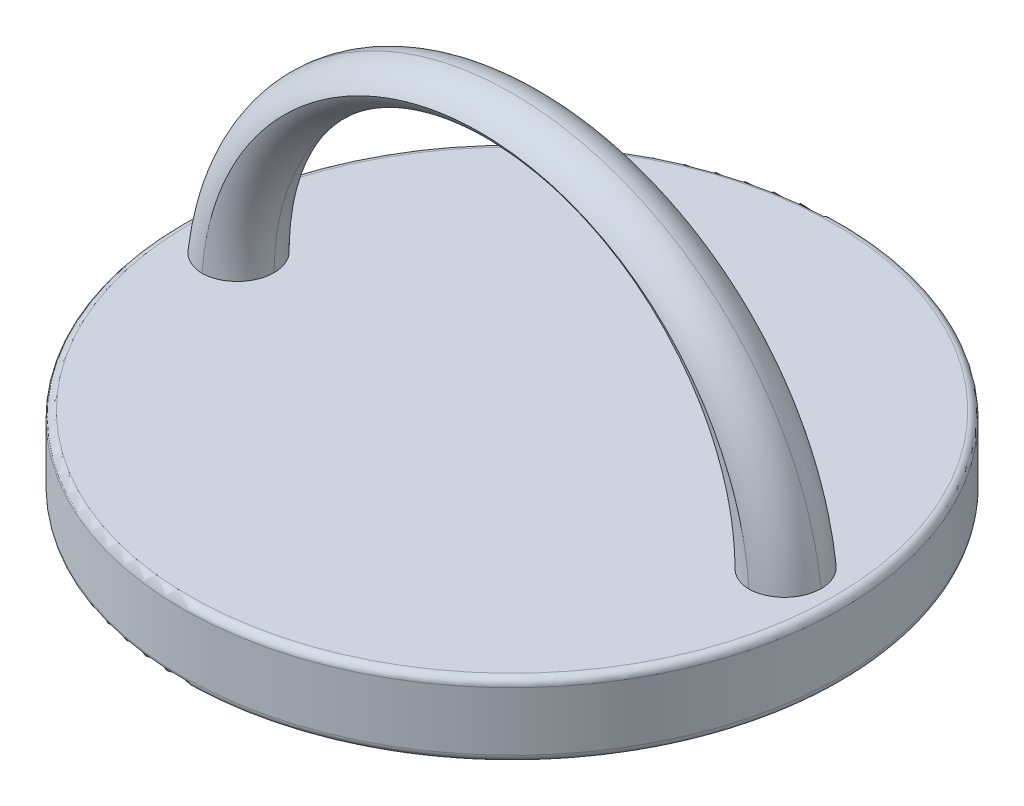
from build123d import *

# Parameters (mm, degrees)
BOSS_EXTRUDE1_DEPTH = 10
FILLET1_R           = 5
FILLET2_R           = 1


# Some blends are built 0.0001 mm under size
with BuildPart() as part:
    # Sketch1 → Revolve1 (revolve)
    with BuildSketch(Plane.XY, mode=Mode.PRIVATE) as revolve1_sk:
        with BuildLine():
            Line((45, 0), (0, 0))
            Line((0, 0), (0, -5))
            Line((0, -5), (41, -5))
            ThreePointArc((41, -5), (42.414213562, -5.585786438), (43, -7))
            Line((43, -7), (43, -10))
            Line((43, -10), (45, -10))
            Line((45, -10), (45, 0))
        make_face()
    revolve(revolve1_sk.sketch.rotate(Axis((0, 0, 0), (0, -1, 0)), 180), axis=Axis((0, 0, 0), (0, -1, 0)))

    # Sketch2 → Boss-Extrude1 (add)
    with BuildSketch(Plane.XY.offset(5)):
        with BuildLine():
            ThreePointArc((42.20485754, 0), (0, 37.5), (-42.20485754, 0))
            Line((-42.20485754, 0), (-32.5, 0))
            ThreePointArc((-32.5, 0), (0, 32.5), (32.5, 0))
            Line((32.5, 0), (42.20485754, 0))
        make_face()
    extrude(amount=-BOSS_EXTRUDE1_DEPTH)

    # Fillet1
    # the kernel refuses this fillet: 5 mm, written as the material it takes off along each edge
    with BuildSketch(Plane(origin=(0, 0, -5), x_dir=(-1, 0, 0), z_dir=(0, -1, 0))) as fillet1_piece_1:
        with BuildLine():
            CenterArc((32.5 + FILLET1_R, -FILLET1_R), FILLET1_R, 90, 90)
            Line((32.5 + FILLET1_R, 0), (32.5 + FILLET1_R, FILLET1_R * 0.02))
            Line((32.5 + FILLET1_R, FILLET1_R * 0.02), (32.5 - FILLET1_R * 0.02, FILLET1_R * 0.02))
            Line((32.5 - FILLET1_R * 0.02, FILLET1_R * 0.02), (32.5 - FILLET1_R * 0.02, -FILLET1_R))
            Line((32.5 - FILLET1_R * 0.02, -FILLET1_R), (32.5, -FILLET1_R))
        make_face()
    revolve(axis=Axis((0, 0, -5), (0, 0, -1)), revolution_arc=180, mode=Mode.SUBTRACT)
    with BuildSketch(Plane(origin=(0, 0, 5), x_dir=(-1, 0, 0), z_dir=(0, -1, 0))) as fillet1_piece_2:
        with BuildLine():
            CenterArc((32.5 + FILLET1_R, FILLET1_R), FILLET1_R, 180, 90)
            Line((32.5, FILLET1_R), (32.5 - FILLET1_R * 0.02, FILLET1_R))
            Line((32.5 - FILLET1_R * 0.02, FILLET1_R), (32.5 - FILLET1_R * 0.02, -FILLET1_R * 0.02))
            Line((32.5 - FILLET1_R * 0.02, -FILLET1_R * 0.02), (32.5 + FILLET1_R, -FILLET1_R * 0.02))
            Line((32.5 + FILLET1_R, -FILLET1_R * 0.02), (32.5 + FILLET1_R, 0))
        make_face()
    revolve(axis=Axis((0, 0, 5), (0, 0, -1)), revolution_arc=180, mode=Mode.SUBTRACT)
    with BuildSketch(Plane(origin=(0, -5, -5), x_dir=(0.9844463409038275, -0.1756855198389009, 0), z_dir=(-0.1756855198389009, -0.9844463409038275, 0))) as fillet1_piece_3_section:
        with BuildLine():
            CenterArc((42.5 - FILLET1_R, FILLET1_R), FILLET1_R, 270, 90)
            Line((42.5, FILLET1_R), (42.5 + FILLET1_R * 0.02, FILLET1_R))
            Line((42.5 + FILLET1_R * 0.02, FILLET1_R), (42.5 + FILLET1_R * 0.02, -FILLET1_R * 0.02))
            Line((42.5 + FILLET1_R * 0.02, -FILLET1_R * 0.02), (42.5 - FILLET1_R, -FILLET1_R * 0.02))
            Line((42.5 - FILLET1_R, -FILLET1_R * 0.02), (42.5 - FILLET1_R, 0))
        make_face()
    fillet1_piece_3 = revolve(axis=Axis((0, -5, -5), (0, 0, 1)), revolution_arc=200.23710717, mode=Mode.PRIVATE)
    fillet1_piece_3 = split(fillet1_piece_3, bisect_by=Plane(origin=(0, 0, -3.60019313), z_dir=(0, 1, 0)), keep=Keep.TOP, mode=Mode.PRIVATE)
    add(fillet1_piece_3, mode=Mode.SUBTRACT)
    with BuildSketch(Plane(origin=(0, -5, 5), x_dir=(0.9844463409038275, -0.1756855198389009, 0), z_dir=(-0.1756855198389009, -0.9844463409038275, 0))) as fillet1_piece_4_section:
        with BuildLine():
            CenterArc((42.5 - FILLET1_R, -FILLET1_R), FILLET1_R, 0, 90)
            Line((42.5, -FILLET1_R), (42.5 + FILLET1_R * 0.02, -FILLET1_R))
            Line((42.5 + FILLET1_R * 0.02, -FILLET1_R), (42.5 + FILLET1_R * 0.02, FILLET1_R * 0.02))
            Line((42.5 + FILLET1_R * 0.02, FILLET1_R * 0.02), (42.5 - FILLET1_R, FILLET1_R * 0.02))
            Line((42.5 - FILLET1_R, FILLET1_R * 0.02), (42.5 - FILLET1_R, 0))
        make_face()
    fillet1_piece_4 = revolve(axis=Axis((0, -5, 5), (0, 0, 1)), revolution_arc=200.23710717, mode=Mode.PRIVATE)
    fillet1_piece_4 = split(fillet1_piece_4, bisect_by=Plane(origin=(0, 0, 3.60019313), z_dir=(0, 1, 0)), keep=Keep.TOP, mode=Mode.PRIVATE)
    add(fillet1_piece_4, mode=Mode.SUBTRACT)

    # Fillet2
    fillet2_edges = [part.edges().sort_by_distance(p)[0] for p in [
        (45, 0, 0),
        (45, -10, 0),
        (43, -10, 0),
    ]]
    fillet(fillet2_edges, radius=FILLET2_R - 0.0001)  # a hair under: the kernel refuses the full size


solid = part.part
